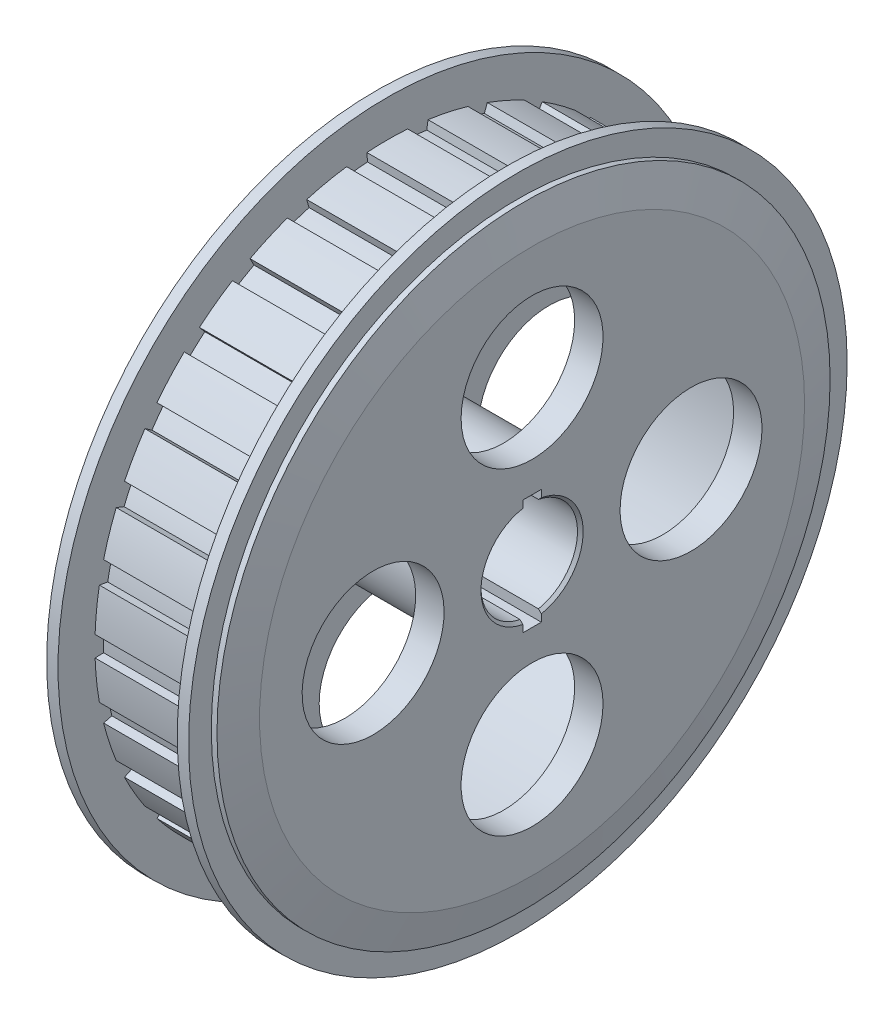
from build123d import *

# Parameters (mm, degrees)
BOSS_EXTRUDE1_START = -10.5
BOSS_EXTRUDE1_DEPTH = 10.5
CIRPATTERN1_COUNT   = 30
CHAMFER1_SIZE       = 0.5
SHELL1_START        = -10
SHELL1_OUTLINE_R    = 45
SHELL1_OUTLINE_R_2  = 13.5
SHELL1_DEPTH        = 10
SKETCH3_R           = 12.5
CUT_EXTRUDE1_DEPTH  = 88.338422244
CIRPATTERN2_COUNT   = 4
SKETCH4_W           = 3.25
SKETCH4_H           = 3.25
CUT_EXTRUDE2_DEPTH  = 88.338422244
CIRPATTERN3_COUNT   = 2


# Read off the part's stored shape, not the designer's step: Shell1
with BuildPart() as part:
    # Sketch1 → Revolve1 (revolve)
    with BuildSketch(Plane.XY, mode=Mode.PRIVATE) as revolve1_sk:
        Polygon((0, 8.5), (0, 50), (-10.5, 50), (-10.5, 58), (-12.5, 58), (-12.5, 54), (-13.5, 54), (-15, 48), (-15, 8.5), align=None)
    revolve(revolve1_sk.sketch.rotate(Axis((0, 0, 0), (-1, 0, 0)), 90), axis=Axis((0, 0, 0), (-1, 0, 0)))

    # Sketch2 → Boss-Extrude1 (add)
    with BuildSketch(Plane(origin=(0, 0, 0), x_dir=(0, 0, -1), z_dir=(1, 0, 0)).offset(BOSS_EXTRUDE1_START)):
        with BuildLine():
            ThreePointArc((0, 50), (1.744974835, 49.969541351), (3.487823687, 49.878202513))
            Line((3.487823687, 49.878202513), (3.592458398, 51.374548588))
            ThreePointArc((3.592458398, 51.374548588), (1.79732408, 51.468627591), (0, 51.5))
            Line((0, 51.5), (0, 50))
        make_face()
        with BuildLine():
            ThreePointArc((-3.487823687, 49.878202513), (-1.744974835, 49.969541351), (0, 50))
            Line((0, 50), (0, 51.5))
            ThreePointArc((0, 51.5), (-1.79732408, 51.468627591), (-3.592458398, 51.374548588))
            Line((-3.592458398, 51.374548588), (-3.487823687, 49.878202513))
        make_face()
    boss_extrude1 = extrude(amount=BOSS_EXTRUDE1_DEPTH)

    # CirPattern1: Boss-Extrude1 ×30 about axis
    cirpattern1_axis = Axis((0, 0, 0), (1, 0, 0))
    for i in range(1, CIRPATTERN1_COUNT):
        add(boss_extrude1.rotate(cirpattern1_axis, i * 360 / CIRPATTERN1_COUNT))

    # Chamfer1
    chamfer1_edges = [part.edges().sort_by_distance(p)[0] for p in [
        (-15, 0, 8.5),
    ]]
    chamfer(chamfer1_edges, length=CHAMFER1_SIZE)

    # Shell1 outline → Shell1 (cut)
    with BuildSketch(Plane.YZ.offset(SHELL1_START)):
        Circle(SHELL1_OUTLINE_R)
        Circle(SHELL1_OUTLINE_R_2, mode=Mode.SUBTRACT)
    extrude(amount=SHELL1_DEPTH, mode=Mode.SUBTRACT)

    # Mirror1: part across face


with BuildPart() as part_1:
    add(part.part)
    add(part.part.mirror(Plane(origin=(0, 0, 0), x_dir=(0, 0, 1), z_dir=(1, 0, 0))))

    # Sketch3 → Cut-Extrude1 (cut, symmetric)
    with BuildSketch(Plane.ZY.offset(15)):
        with Locations((0, 28)):
            Circle(SKETCH3_R)
    cut_extrude1 = extrude(amount=CUT_EXTRUDE1_DEPTH, both=True, mode=Mode.SUBTRACT)

    # CirPattern2: Cut-Extrude1 ×4 about axis
    cirpattern2_axis = Axis((0, 0, 0), (1, 0, 0))
    for i in range(1, CIRPATTERN2_COUNT):
        add(cut_extrude1.rotate(cirpattern2_axis, i * 360 / CIRPATTERN2_COUNT), mode=Mode.SUBTRACT)

    # Sketch4 → Cut-Extrude2 (cut, symmetric)
    with BuildSketch(Plane(origin=(15, 0, 0), x_dir=(0, 0, -1), z_dir=(1, 0, 0))):
        with Locations((0, 8.5)):
            Rectangle(SKETCH4_W, SKETCH4_H)
    cut_extrude2 = extrude(amount=CUT_EXTRUDE2_DEPTH, both=True, mode=Mode.SUBTRACT)

    # CirPattern3: Cut-Extrude2 ×2 about axis
    cirpattern3_axis = Axis((0, 0, 0), (1, 0, 0))
    for i in range(1, CIRPATTERN3_COUNT):
        add(cut_extrude2.rotate(cirpattern3_axis, i * 360 / CIRPATTERN3_COUNT), mode=Mode.SUBTRACT)


solid = part_1.part
